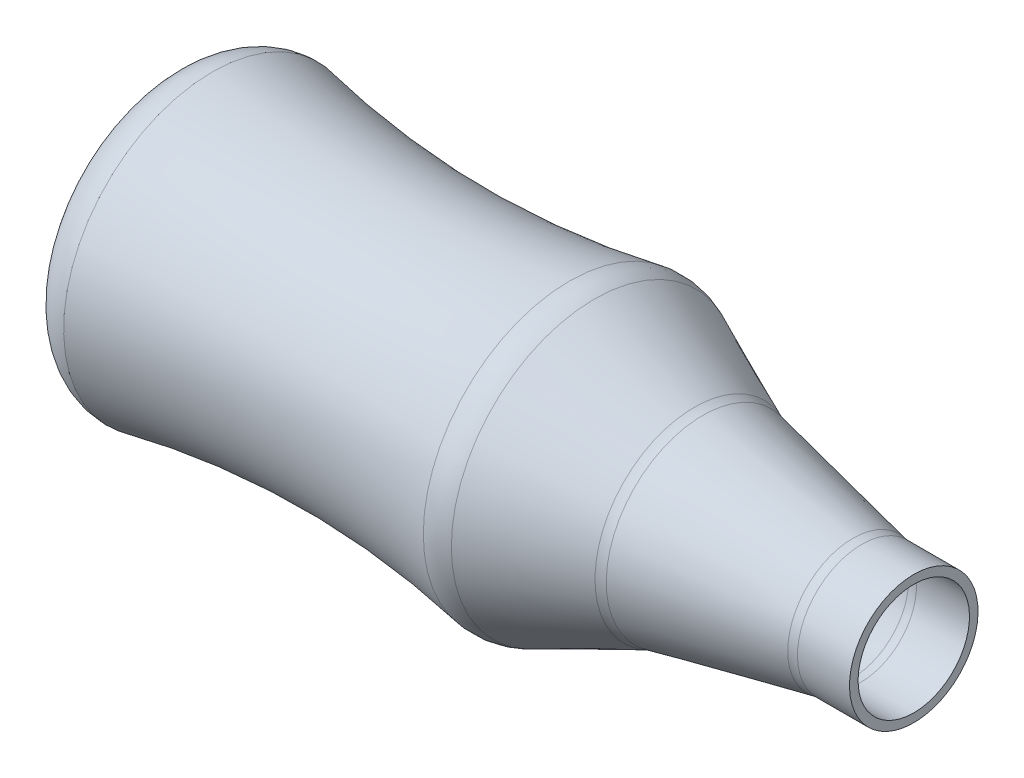
from build123d import *

# Parameters (mm, degrees)
BOSS_EXTRUDE1_START = 2
SKETCH2_R           = 24.705
BOSS_EXTRUDE1_DEPTH = 2
FILLET1_R           = 10
FILLET2_R           = 10


# Read off the part's stored shape, not the designer's step: Shell2
with BuildPart() as part:
    # Sketch1 → Revolve1 (revolve)
    with BuildSketch(Plane.XY):
        with BuildLine():
            Line((-173.75, 0), (0, 0))
            Line((0, 0), (0, 15))
            Line((0, 15), (-13.19, 15))
            Line((-13.19, 15), (-50.28, 22.75))
            Line((-50.28, 22.75), (-77.37, 34.705))
            ThreePointArc((-77.37, 34.705), (-120.56, 30.423853835), (-163.75, 34.705))
            ThreePointArc((-163.75, 34.705), (-170.821067812, 31.776067812), (-173.75, 24.705))
            Line((-173.75, 24.705), (-173.75, 0))
        make_face()
    revolve(axis=Axis((0, 0, 0), (-1, 0, 0)))

    # Shell2 outline → Shell2 (revolve, cut)
    with BuildSketch(Plane.YX):
        with BuildLine():
            Line((24.705, -173.75), (24.705, -171.75))
            ThreePointArc((24.705, -171.75), (30.295405132, -169.472531822), (32.702817817, -163.936842615))
            ThreePointArc((32.702817817, -163.936842615), (28.423955347, -120.772299747), (32.620253078, -77.599652035))
            Line((32.620253078, -77.599652035), (20.835311789, -50.895004646))
            Line((20.835311789, -50.895004646), (13, -13.396718937))
            Line((13, -13.396718937), (13, 0))
            Line((13, 0), (0, 0))
            Line((0, 0), (0, -173.75))
            Line((0, -173.75), (24.705, -173.75))
        make_face()
    revolve(axis=Axis((0, 0, 0), (1, 0, 0)), mode=Mode.SUBTRACT)

    # Sketch2 → Boss-Extrude1 (add)
    with BuildSketch(Plane(origin=(-173.75, 0, 0), x_dir=(0, 0, -1), z_dir=(1, 0, 0)).offset(BOSS_EXTRUDE1_START)):
        Circle(SKETCH2_R)
    extrude(amount=-BOSS_EXTRUDE1_DEPTH)

    # Fillet1
    fillet1_edges = [part.edges().sort_by_distance(p)[0] for p in [
        (-77.37, -34.705, 0),
        (-50.28, -22.75, 0),
        (-13.19, -15, 0),
    ]]
    fillet(fillet1_edges, radius=FILLET1_R)

    # Fillet2
    fillet2_edges = [part.edges().sort_by_distance(p)[0] for p in [
        (-13.396718937, -13, 0),
    ]]
    fillet(fillet2_edges, radius=FILLET2_R)


solid = part.part
